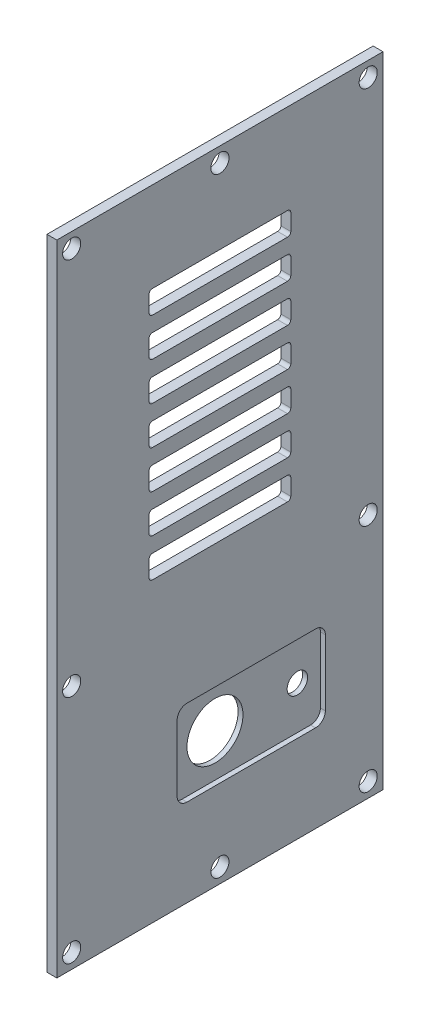
from build123d import *

# Parameters (mm, degrees)
SKETCH1_W           = 99
SKETCH1_H           = 194
BOSS_EXTRUDE1_DEPTH = 3
SKETCH2_W           = 43
SKETCH2_H           = 7
CUT_EXTRUDE1_DEPTH  = 124.489956292
FILLET1_R           = 1
SKETCH3_R           = 8.5
SKETCH3_R_2         = 3.1
CUT_EXTRUDE2_DEPTH  = 124.489956292
SKETCH4_W           = 45
SKETCH4_H           = 26
CUT_EXTRUDE3_DEPTH  = 1.5
FILLET2_R           = 3
SKETCH5_R           = 2.75
CUT_EXTRUDE4_DEPTH  = 124.489956292


with BuildPart() as part:
    # Sketch1 → Boss-Extrude1 (new body)
    with BuildSketch(Plane.ZY.offset(74.98828393)):
        with Locations((-16.230657269, 7.5)):
            Rectangle(SKETCH1_W, SKETCH1_H)
    extrude(amount=BOSS_EXTRUDE1_DEPTH)

    # Sketch2 → Cut-Extrude1 (cut, through all)
    with BuildSketch(Plane.ZY.offset(77.98828393)):
        with Locations((-16.230657269, 73.75)):
            Rectangle(SKETCH2_W, SKETCH2_H)
        with Locations((-16.230657269, 62.15)):
            Rectangle(SKETCH2_W, SKETCH2_H)
        with Locations((-16.230657269, 50.55)):
            Rectangle(SKETCH2_W, SKETCH2_H)
        with Locations((-16.230657269, 38.95)):
            Rectangle(SKETCH2_W, SKETCH2_H)
        with Locations((-16.230657269, 27.35)):
            Rectangle(SKETCH2_W, SKETCH2_H)
        with Locations((-16.230657269, 15.75)):
            Rectangle(SKETCH2_W, SKETCH2_H)
        with Locations((-16.230657269, 4.15)):
            Rectangle(SKETCH2_W, SKETCH2_H)
    extrude(amount=-CUT_EXTRUDE1_DEPTH, mode=Mode.SUBTRACT)

    # Fillet1
    fillet1_edges = [part.edges().sort_by_distance(p)[0] for p in [
        (-76.48828393, 7.65, 5.269342731),
        (-76.48828393, 0.65, 5.269342731),
        (-76.48828393, 0.65, -37.730657269),
        (-76.48828393, 7.65, -37.730657269),
        (-76.48828393, 12.25, -37.730657269),
        (-76.48828393, 19.25, -37.730657269),
        (-76.48828393, 12.25, 5.269342731),
        (-76.48828393, 19.25, 5.269342731),
        (-76.48828393, 23.85, 5.269342731),
        (-76.48828393, 23.85, -37.730657269),
        (-76.48828393, 30.85, -37.730657269),
        (-76.48828393, 30.85, 5.269342731),
        (-76.48828393, 42.45, 5.269342731),
        (-76.48828393, 35.45, 5.269342731),
        (-76.48828393, 35.45, -37.730657269),
        (-76.48828393, 42.45, -37.730657269),
        (-76.48828393, 47.05, -37.730657269),
        (-76.48828393, 54.05, -37.730657269),
        (-76.48828393, 47.05, 5.269342731),
        (-76.48828393, 54.05, 5.269342731),
        (-76.48828393, 58.65, 5.269342731),
        (-76.48828393, 65.65, 5.269342731),
        (-76.48828393, 65.65, -37.730657269),
        (-76.48828393, 58.65, -37.730657269),
        (-76.48828393, 70.25, -37.730657269),
        (-76.48828393, 77.25, -37.730657269),
        (-76.48828393, 70.25, 5.269342731),
        (-76.48828393, 77.25, 5.269342731),
    ]]
    fillet(fillet1_edges, radius=FILLET1_R)

    # Sketch3 → Cut-Extrude2 (cut, through all)
    with BuildSketch(Plane.ZY.offset(77.98828393)):
        with Locations((-16.230657269, -50)):
            Circle(SKETCH3_R)
        with Locations((-41.230657269, -50)):
            Circle(SKETCH3_R_2)
    extrude(amount=-CUT_EXTRUDE2_DEPTH, mode=Mode.SUBTRACT)

    # Sketch4 → Cut-Extrude3 (cut)
    with BuildSketch(Plane(origin=(-74.98828393, 0, 0), x_dir=(0, 0, -1), z_dir=(1, 0, 0))):
        with Locations((25.730657269, -50)):
            Rectangle(SKETCH4_W, SKETCH4_H)
    extrude(amount=-CUT_EXTRUDE3_DEPTH, mode=Mode.SUBTRACT)

    # Fillet2
    fillet2_edges = [part.edges().sort_by_distance(p)[0] for p in [
        (-75.73828393, -63, -48.230657269),
        (-75.73828393, -37, -48.230657269),
        (-75.73828393, -63, -3.230657269),
        (-75.73828393, -37, -3.230657269),
    ]]
    fillet(fillet2_edges, radius=FILLET2_R)

    # Sketch5 → Cut-Extrude4 (cut, through all)
    with BuildSketch(Plane.ZY.offset(77.98828393)):
        with Locations((-61.230657269, 100)):
            Circle(SKETCH5_R)
        with Locations((28.769342731, 100)):
            Circle(SKETCH5_R)
        with Locations((-61.230657269, -15)):
            Circle(SKETCH5_R)
        with Locations((-61.230657269, -85)):
            Circle(SKETCH5_R)
        with Locations((28.769342731, -85)):
            Circle(SKETCH5_R)
        with Locations((28.769342731, -15)):
            Circle(SKETCH5_R)
        with Locations((-16.230657269, 100)):
            Circle(SKETCH5_R)
        with Locations((-16.230657269, -85)):
            Circle(SKETCH5_R)
    extrude(amount=-CUT_EXTRUDE4_DEPTH, mode=Mode.SUBTRACT)


solid = part.part
